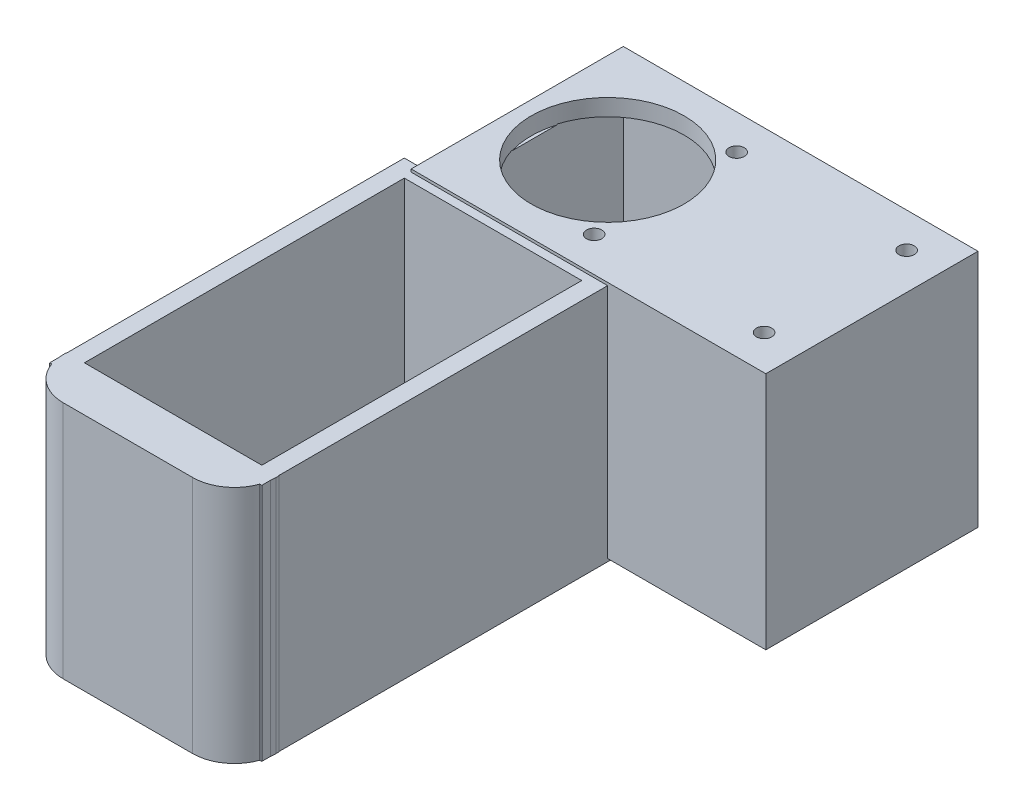
from build123d import *

# Parameters (mm, degrees)
S_BOX1_W      = 30.52
S_BOX1_H      = 34.4
BOSS_1_DEPTH  = 2.5
S_BOX2_W      = 30.52
S_BOX2_H      = 34.4
BOSS_2_DEPTH  = 2.5
S_BOX3_W      = 2.5
S_BOX3_H      = 34.4
BOSS_3_DEPTH  = 51.02
S_BOX4_W      = 2.5
S_BOX4_H      = 34.4
BOSS_4_DEPTH  = 51.02
S_BOX5_W      = 30.52
S_BOX5_H      = 2.4
BOSS_5_DEPTH  = 51.02
S_BOX6_W      = 2.5
S_BOX6_H      = 34.4
BOSS_6_DEPTH  = 30.52
S_BOX7_W      = 2.5
S_BOX7_H      = 34.4
BOSS_7_DEPTH  = 30.52
S_BOX8_W      = 51.02
S_BOX8_H      = 34.4
BOSS_8_DEPTH  = 2.5
S_BOX9_W      = 51.02
S_BOX9_H      = 34.4
BOSS_9_DEPTH  = 2.5
S_BOX10_W     = 51.02
S_BOX10_H     = 2.4
BOSS_10_DEPTH = 30.52
BOSS_11_DEPTH = 34.4
S_HOLE12_R    = 11
HOLE_12_DEPTH = 2.6
S_HOLE13_R    = 1.1
HOLE_13_DEPTH = 2.6
S_HOLE14_R    = 1.1
HOLE_14_DEPTH = 2.6
S_HOLE15_R    = 1.1
HOLE_15_DEPTH = 2.6
S_HOLE16_R    = 1.1
HOLE_16_DEPTH = 2.6
S_HOLE17_R    = 11
HOLE_17_DEPTH = 2.6
S_HOLE18_R    = 1.1
HOLE_18_DEPTH = 2.6
S_HOLE19_R    = 1.1
HOLE_19_DEPTH = 2.6
S_HOLE20_R    = 1.1
HOLE_20_DEPTH = 2.6
S_HOLE21_R    = 1.1
HOLE_21_DEPTH = 2.6


with BuildPart() as part:
    # S_box1 → Boss_1 (new body)
    with BuildSketch(Plane.XY.offset(-38.01)):
        with Locations((0, -19.825)):
            Rectangle(S_BOX1_W, S_BOX1_H)
    extrude(amount=BOSS_1_DEPTH)



with BuildPart() as body_2:
    # S_box2 → Boss_2 (new body)
    with BuildSketch(Plane.XY.offset(10.51)):
        with Locations((0, -19.825)):
            Rectangle(S_BOX2_W, S_BOX2_H)
    extrude(amount=BOSS_2_DEPTH)


with BuildPart() as part_1:
    add(part.part)

    add(body_2.part)  # Boss_3 merges body 2
    # S_box3 → Boss_3 (add)
    with BuildSketch(Plane.XY.offset(-38.01)):
        with Locations((-14.01, -19.825)):
            Rectangle(S_BOX3_W, S_BOX3_H)
    extrude(amount=BOSS_3_DEPTH)

    # S_box4 → Boss_4 (add)
    with BuildSketch(Plane.XY.offset(-38.01)):
        with Locations((14.01, -19.825)):
            Rectangle(S_BOX4_W, S_BOX4_H)
    extrude(amount=BOSS_4_DEPTH)

    # S_box5 → Boss_5 (add)
    with BuildSketch(Plane.XY.offset(-38.01)):
        with Locations((0, -35.825)):
            Rectangle(S_BOX5_W, S_BOX5_H)
    extrude(amount=BOSS_5_DEPTH)

    # S_box6 → Boss_6 (add)
    with BuildSketch(Plane.XY.offset(-67.26)):
        with Locations((-11.76, -19.425)):
            Rectangle(S_BOX6_W, S_BOX6_H)
    extrude(amount=BOSS_6_DEPTH)



with BuildPart() as body_2_2:
    # S_box7 → Boss_7 (new body)
    with BuildSketch(Plane.XY.offset(-67.26)):
        with Locations((36.76, -19.425)):
            Rectangle(S_BOX7_W, S_BOX7_H)
    extrude(amount=BOSS_7_DEPTH)


with BuildPart() as part_2:
    add(part_1.part)

    add(body_2_2.part)  # Boss_8 merges body 2 2
    # S_box8 → Boss_8 (add)
    with BuildSketch(Plane.XY.offset(-67.26)):
        with Locations((12.5, -19.425)):
            Rectangle(S_BOX8_W, S_BOX8_H)
    extrude(amount=BOSS_8_DEPTH)

    # S_box9 → Boss_9 (add)
    with BuildSketch(Plane.XY.offset(-39.24)):
        with Locations((12.5, -19.425)):
            Rectangle(S_BOX9_W, S_BOX9_H)
    extrude(amount=BOSS_9_DEPTH)

    # S_box10 → Boss_10 (add)
    with BuildSketch(Plane.XY.offset(-67.26)):
        with Locations((12.5, -3.425)):
            Rectangle(S_BOX10_W, S_BOX10_H)
    extrude(amount=BOSS_10_DEPTH)

    # S_prism11 → Boss_11 (add)
    with BuildSketch(Plane(origin=(0, -37.025, 0), x_dir=(1, 0, 0), z_dir=(0, 1, 0))):
        with BuildLine():
            Line((-15.31, -10.56), (15.31, -10.56))
            Line((15.31, -10.56), (15.31, -11.01))
            ThreePointArc((15.31, -11.01), (13.5526, -15.2526), (9.31, -17.01))
            Line((9.31, -17.01), (-9.31, -17.01))
            ThreePointArc((-9.31, -17.01), (-13.5526, -15.2526), (-15.31, -11.01))
            Line((-15.31, -11.01), (-15.31, -10.56))
        make_face()
    extrude(amount=BOSS_11_DEPTH)

    # S_hole12 → Hole_12 (cut)
    with BuildSketch(Plane(origin=(0, -37.125, 0), x_dir=(1, 0, 0), z_dir=(0, 1, 0))):
        Circle(S_HOLE12_R)
    extrude(amount=HOLE_12_DEPTH, mode=Mode.SUBTRACT)

    # S_hole13 → Hole_13 (cut)
    with BuildSketch(Plane(origin=(0, -37.125, 0), x_dir=(1, 0, 0), z_dir=(0, 1, 0))):
        with Locations((-10.25, 8.3)):
            Circle(S_HOLE13_R)
    extrude(amount=HOLE_13_DEPTH, mode=Mode.SUBTRACT)

    # S_hole14 → Hole_14 (cut)
    with BuildSketch(Plane(origin=(0, -37.125, 0), x_dir=(1, 0, 0), z_dir=(0, 1, 0))):
        with Locations((10.25, 8.3)):
            Circle(S_HOLE14_R)
    extrude(amount=HOLE_14_DEPTH, mode=Mode.SUBTRACT)

    # S_hole15 → Hole_15 (cut)
    with BuildSketch(Plane(origin=(0, -37.125, 0), x_dir=(1, 0, 0), z_dir=(0, 1, 0))):
        with Locations((-10.25, 32.75)):
            Circle(S_HOLE15_R)
    extrude(amount=HOLE_15_DEPTH, mode=Mode.SUBTRACT)

    # S_hole16 → Hole_16 (cut)
    with BuildSketch(Plane(origin=(0, -37.125, 0), x_dir=(1, 0, 0), z_dir=(0, 1, 0))):
        with Locations((10.25, 32.75)):
            Circle(S_HOLE16_R)
    extrude(amount=HOLE_16_DEPTH, mode=Mode.SUBTRACT)

    # S_hole17 → Hole_17 (cut)
    with BuildSketch(Plane(origin=(0, -4.725, 0), x_dir=(1, 0, 0), z_dir=(0, 1, 0))):
        with Locations((0, 52)):
            Circle(S_HOLE17_R)
    extrude(amount=HOLE_17_DEPTH, mode=Mode.SUBTRACT)

    # S_hole18 → Hole_18 (cut)
    with BuildSketch(Plane(origin=(0, -4.725, 0), x_dir=(1, 0, 0), z_dir=(0, 1, 0))):
        with Locations((8.3, 62.25)):
            Circle(S_HOLE18_R)
    extrude(amount=HOLE_18_DEPTH, mode=Mode.SUBTRACT)

    # S_hole19 → Hole_19 (cut)
    with BuildSketch(Plane(origin=(0, -4.725, 0), x_dir=(1, 0, 0), z_dir=(0, 1, 0))):
        with Locations((8.3, 41.75)):
            Circle(S_HOLE19_R)
    extrude(amount=HOLE_19_DEPTH, mode=Mode.SUBTRACT)

    # S_hole20 → Hole_20 (cut)
    with BuildSketch(Plane(origin=(0, -4.725, 0), x_dir=(1, 0, 0), z_dir=(0, 1, 0))):
        with Locations((32.75, 62.25)):
            Circle(S_HOLE20_R)
    extrude(amount=HOLE_20_DEPTH, mode=Mode.SUBTRACT)

    # S_hole21 → Hole_21 (cut)
    with BuildSketch(Plane(origin=(0, -4.725, 0), x_dir=(1, 0, 0), z_dir=(0, 1, 0))):
        with Locations((32.75, 41.75)):
            Circle(S_HOLE21_R)
    extrude(amount=HOLE_21_DEPTH, mode=Mode.SUBTRACT)


solid = part_2.part
